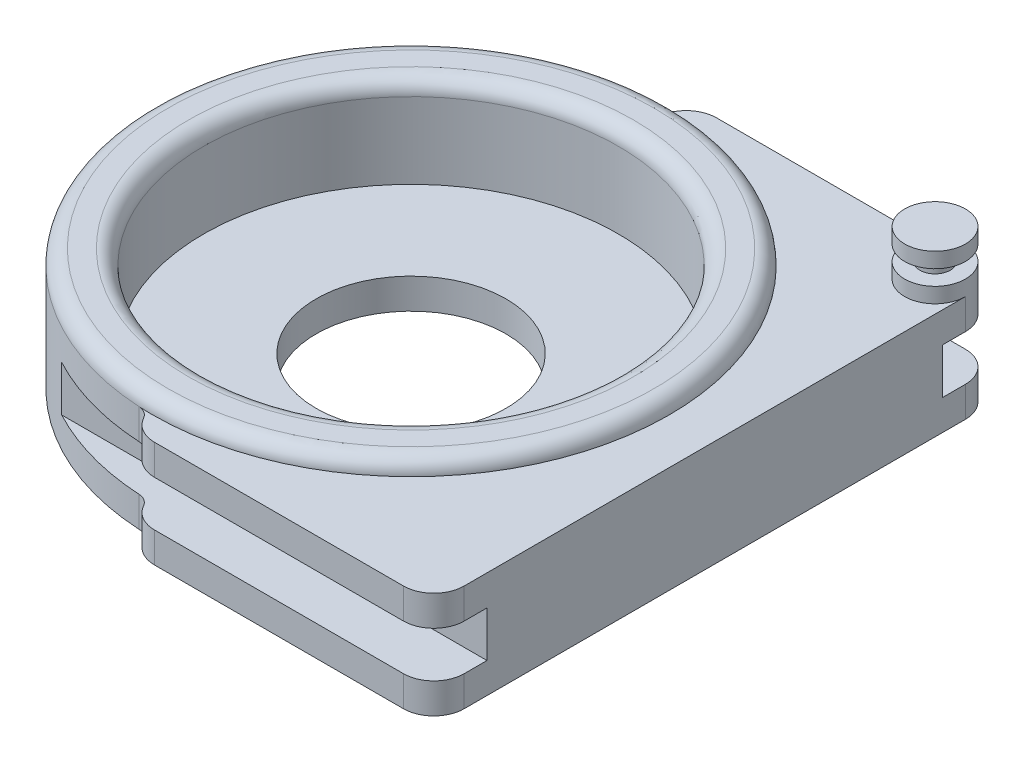
from build123d import *

# Parameters (mm, degrees)
EXTRUDE_1_DEPTH      = 2
EXTRUDE_2_DEPTH      = 3
EXTRUDE_3_DEPTH      = 2
CUT_EXTRUDE_START    = -5
SKETCH_4_R           = 13.65
SKETCH_4_R_2         = 6.25
CUT_EXTRUDE_4_DEPTH  = 5
SKETCH_4_3_R         = 13.65
EXTRUDE_5_DEPTH      = 1
FILLET_2_R           = 1
FILLET_3_R           = 2
EXTRUDE_6_DEPTH      = 1
SKETCH_6_R           = 1
EXTRUDE_7_DEPTH      = 1
SKETCH_7_R           = 2
EXTRUDE_8_DEPTH      = 1
CUT_EXTRUDE_10_DEPTH = 5


with BuildPart() as part:
    # 草图1 → 拉伸1 (new body)
    with BuildSketch(Plane(origin=(0, 0, 0), x_dir=(1, 0, 0), z_dir=(0, 1, 0))):
        with BuildLine():
            Line((0, 15), (-8, 15))
            ThreePointArc((-8, 15), (-14.577379737, 8.746427842), (-17, 0))
            ThreePointArc((-17, 0), (-14.577379737, -8.746427842), (-8, -15))
            Line((-8, -15), (0, -15))
            Line((0, -15), (0, -6.25))
            ThreePointArc((0, -6.25), (-6.25, 0), (0, 6.25))
            Line((0, 6.25), (0, 15))
        make_face()
        with BuildLine():
            Line((8, 15), (0, 15))
            Line((0, 15), (0, 6.25))
            ThreePointArc((0, 6.25), (4.419417382, 4.419417382), (6.25, 0))
            ThreePointArc((6.25, 0), (4.419417382, -4.419417382), (0, -6.25))
            Line((0, -6.25), (0, -15))
            Line((0, -15), (8, -15))
            ThreePointArc((8, -15), (14.577379737, -8.746427842), (17, 0))
            ThreePointArc((17, 0), (14.577379737, 8.746427842), (8, 15))
        make_face()
        with BuildLine():
            Line((0, 15), (-8, 15))
            ThreePointArc((-8, 15), (-14.577379737, 8.746427842), (-17, 0))
            ThreePointArc((-17, 0), (-14.577379737, -8.746427842), (-8, -15))
            Line((-8, -15), (0, -15))
            Line((0, -15), (0, -6.25))
            ThreePointArc((0, -6.25), (-6.25, 0), (0, 6.25))
            Line((0, 6.25), (0, 15))
        make_face()
        with BuildLine():
            Line((8, 15), (0, 15))
            Line((0, 15), (0, 6.25))
            ThreePointArc((0, 6.25), (4.419417382, 4.419417382), (6.25, 0))
            ThreePointArc((6.25, 0), (4.419417382, -4.419417382), (0, -6.25))
            Line((0, -6.25), (0, -15))
            Line((0, -15), (8, -15))
            ThreePointArc((8, -15), (14.577379737, -8.746427842), (17, 0))
            ThreePointArc((17, 0), (14.577379737, 8.746427842), (8, 15))
        make_face()
        with BuildLine():
            Line((20, 15), (8, 15))
            ThreePointArc((8, 15), (14.577379737, 8.746427842), (17, 0))
            ThreePointArc((17, 0), (14.577379737, -8.746427842), (8, -15))
            Line((8, -15), (20, -15))
            Line((20, -15), (20, 15))
        make_face()
        with BuildLine():
            Line((0, 18.5), (0, 17))
            ThreePointArc((0, 17), (4.123105626, 16.492422502), (8, 15))
            Line((8, 15), (20, 15))
            Line((20, 15), (20, 18.5))
            Line((20, 18.5), (0, 18.5))
        make_face()
        with BuildLine():
            ThreePointArc((8, -15), (4.123105626, -16.492422502), (0, -17))
            Line((0, -17), (0, -18.5))
            Line((0, -18.5), (20, -18.5))
            Line((20, -18.5), (20, -15))
            Line((20, -15), (8, -15))
        make_face()
        with BuildLine():
            ThreePointArc((0, 17), (-4.123105626, 16.492422502), (-8, 15))
            Line((-8, 15), (0, 15))
            Line((0, 15), (0, 17))
        make_face()
        with BuildLine():
            Line((0, 17), (0, 15))
            Line((0, 15), (8, 15))
            ThreePointArc((8, 15), (4.123105626, 16.492422502), (0, 17))
        make_face()
        with BuildLine():
            ThreePointArc((0, 17), (-4.123105626, 16.492422502), (-8, 15))
            Line((-8, 15), (0, 15))
            Line((0, 15), (0, 17))
        make_face()
        with BuildLine():
            Line((0, 17), (0, 15))
            Line((0, 15), (8, 15))
            ThreePointArc((8, 15), (4.123105626, 16.492422502), (0, 17))
        make_face()
        with BuildLine():
            Line((0, -15), (-8, -15))
            ThreePointArc((-8, -15), (-4.123105626, -16.492422502), (0, -17))
            Line((0, -17), (0, -15))
        make_face()
        with BuildLine():
            Line((8, -15), (0, -15))
            Line((0, -15), (0, -17))
            ThreePointArc((0, -17), (4.123105626, -16.492422502), (8, -15))
        make_face()
        with BuildLine():
            Line((0, -15), (-8, -15))
            ThreePointArc((-8, -15), (-4.123105626, -16.492422502), (0, -17))
            Line((0, -17), (0, -15))
        make_face()
        with BuildLine():
            Line((8, -15), (0, -15))
            Line((0, -15), (0, -17))
            ThreePointArc((0, -17), (4.123105626, -16.492422502), (8, -15))
        make_face()
    extrude(amount=EXTRUDE_1_DEPTH)

    # 草图2 → 拉伸2 (add)
    with BuildSketch(Plane(origin=(0, 2, 0), x_dir=(1, 0, 0), z_dir=(0, 1, 0))):
        with BuildLine():
            Line((0, 6.25), (0, 15))
            Line((0, 15), (-8, 15))
            ThreePointArc((-8, 15), (-14.577379737, 8.746427842), (-17, 0))
            ThreePointArc((-17, 0), (-14.577379737, -8.746427842), (-8, -15))
            Line((-8, -15), (0, -15))
            Line((0, -15), (0, -6.25))
            ThreePointArc((0, -6.25), (-6.25, 0), (0, 6.25))
        make_face()
        with BuildLine():
            ThreePointArc((17, 0), (14.577379737, 8.746427842), (8, 15))
            Line((8, 15), (0, 15))
            Line((0, 15), (0, 6.25))
            ThreePointArc((0, 6.25), (4.419417382, 4.419417382), (6.25, 0))
            ThreePointArc((6.25, 0), (4.419417382, -4.419417382), (0, -6.25))
            Line((0, -6.25), (0, -15))
            Line((0, -15), (8, -15))
            ThreePointArc((8, -15), (14.577379737, -8.746427842), (17, 0))
        make_face()
        with BuildLine():
            Line((0, 6.25), (0, 15))
            Line((0, 15), (-8, 15))
            ThreePointArc((-8, 15), (-14.577379737, 8.746427842), (-17, 0))
            ThreePointArc((-17, 0), (-14.577379737, -8.746427842), (-8, -15))
            Line((-8, -15), (0, -15))
            Line((0, -15), (0, -6.25))
            ThreePointArc((0, -6.25), (-6.25, 0), (0, 6.25))
        make_face()
        with BuildLine():
            Line((20, -15), (20, 15))
            Line((20, 15), (8, 15))
            ThreePointArc((8, 15), (14.577379737, 8.746427842), (17, 0))
            ThreePointArc((17, 0), (14.577379737, -8.746427842), (8, -15))
            Line((8, -15), (20, -15))
        make_face()
    extrude(amount=EXTRUDE_2_DEPTH)

    # 草图3 → 拉伸3 (add)
    with BuildSketch(Plane(origin=(0, 5, 0), x_dir=(1, 0, 0), z_dir=(0, 1, 0))):
        with BuildLine():
            Line((0, 6.25), (0, 15))
            Line((0, 15), (-8, 15))
            ThreePointArc((-8, 15), (-14.577379738, 8.746427841), (-17, -3e-09))
            ThreePointArc((-17, -3e-09), (-14.577379736, -8.746427843), (-8, -15))
            Line((-8, -15), (0, -15))
            Line((0, -15), (0, -6.25))
            ThreePointArc((0, -6.25), (-6.25, 0), (0, 6.25))
        make_face()
        with BuildLine():
            ThreePointArc((8, 15), (4.123105626, 16.492422502), (0, 17))
            Line((0, 17), (0, 15))
            Line((0, 15), (8, 15))
        make_face()
        with BuildLine():
            Line((0, 15), (0, 17))
            ThreePointArc((0, 17), (-4.123105626, 16.492422502), (-8, 15))
            Line((-8, 15), (0, 15))
        make_face()
        with BuildLine():
            ThreePointArc((8, 15), (4.123105626, 16.492422502), (0, 17))
            Line((0, 17), (0, 15))
            Line((0, 15), (8, 15))
        make_face()
        with BuildLine():
            Line((0, 15), (0, 17))
            ThreePointArc((0, 17), (-4.123105626, 16.492422502), (-8, 15))
            Line((-8, 15), (0, 15))
        make_face()
        with BuildLine():
            ThreePointArc((17, 0), (14.577379737, 8.746427842), (8, 15))
            Line((8, 15), (0, 15))
            Line((0, 15), (0, 6.25))
            ThreePointArc((0, 6.25), (4.419417382, 4.419417382), (6.25, 0))
            ThreePointArc((6.25, 0), (4.419417382, -4.419417382), (0, -6.25))
            Line((0, -6.25), (0, -15))
            Line((0, -15), (8, -15))
            ThreePointArc((8, -15), (14.577379737, -8.746427842), (17, 0))
        make_face()
        with BuildLine():
            Line((0, 6.25), (0, 15))
            Line((0, 15), (-8, 15))
            ThreePointArc((-8, 15), (-14.577379738, 8.746427841), (-17, -3e-09))
            ThreePointArc((-17, -3e-09), (-14.577379736, -8.746427843), (-8, -15))
            Line((-8, -15), (0, -15))
            Line((0, -15), (0, -6.25))
            ThreePointArc((0, -6.25), (-6.25, 0), (0, 6.25))
        make_face()
        with BuildLine():
            ThreePointArc((0, -17), (4.123105626, -16.492422502), (8, -15))
            Line((8, -15), (0, -15))
            Line((0, -15), (0, -17))
        make_face()
        with BuildLine():
            Line((0, -17), (0, -15))
            Line((0, -15), (-8, -15))
            ThreePointArc((-8, -15), (-4.123105626, -16.492422502), (0, -17))
        make_face()
        with BuildLine():
            ThreePointArc((0, -17), (4.123105626, -16.492422502), (8, -15))
            Line((8, -15), (0, -15))
            Line((0, -15), (0, -17))
        make_face()
        with BuildLine():
            Line((0, -17), (0, -15))
            Line((0, -15), (-8, -15))
            ThreePointArc((-8, -15), (-4.123105626, -16.492422502), (0, -17))
        make_face()
        with BuildLine():
            Line((20, -15), (20, 15))
            Line((20, 15), (8, 15))
            ThreePointArc((8, 15), (14.577379737, 8.746427842), (17, 0))
            ThreePointArc((17, 0), (14.577379737, -8.746427842), (8, -15))
            Line((8, -15), (20, -15))
        make_face()
        with BuildLine():
            Line((20, 15), (20, 18.5))
            Line((20, 18.5), (0, 18.5))
            Line((0, 18.5), (0, 17))
            ThreePointArc((0, 17), (4.123105626, 16.492422502), (8, 15))
            Line((8, 15), (20, 15))
        make_face()
        with BuildLine():
            Line((20, -18.5), (20, -15))
            Line((20, -15), (8, -15))
            ThreePointArc((8, -15), (4.123105626, -16.492422502), (0, -17))
            Line((0, -17), (0, -18.5))
            Line((0, -18.5), (20, -18.5))
        make_face()
    extrude(amount=EXTRUDE_3_DEPTH)

    # 草图4 → 拉伸4 (cut)
    with BuildSketch(Plane(origin=(0, 7, 0), x_dir=(1, 0, 0), z_dir=(0, 1, 0)).offset(CUT_EXTRUDE_START)):
        with Locations(Location((0, 0, 0), (0, 0, 270))):
            Circle(SKETCH_4_R)
        with Locations(Location((0, 0, 0), (0, 0, 270))):
            Circle(SKETCH_4_R_2, mode=Mode.SUBTRACT)
    extrude(amount=CUT_EXTRUDE_4_DEPTH, mode=Mode.SUBTRACT)

    # 草图4<3> → 拉伸5 (add)
    with BuildSketch(Plane(origin=(0, 7, 0), x_dir=(1, 0, 0), z_dir=(0, 1, 0))):
        with BuildLine():
            ThreePointArc((0, 17), (-17, 0), (0, -17))
            ThreePointArc((0, -17), (12.02081528, -12.02081528), (17, 0))
            ThreePointArc((17, 0), (12.02081528, 12.02081528), (0, 17))
        make_face()
        with Locations(Location((0, 0, 0), (0, 0, 270))):
            Circle(SKETCH_4_3_R, mode=Mode.SUBTRACT)
    extrude(amount=EXTRUDE_5_DEPTH)

    # 圆角1: read off the stored shape, not the designer's step
    # 圆角1 outline → 圆角1 (revolve, cut)
    with BuildSketch(Plane.XY):
        with BuildLine():
            ThreePointArc((16, 8), (16.707106781, 7.707106781), (17, 7))
            Line((17, 7), (17, 8))
            Line((17, 8), (16, 8))
        make_face()
        with BuildLine():
            ThreePointArc((13.65, 7), (13.942893219, 7.707106781), (14.65, 8))
            Line((14.65, 8), (13.65, 8))
            Line((13.65, 8), (13.65, 7))
        make_face()
    revolve(axis=Axis((0, 0, 0), (0, 1, 0)), mode=Mode.SUBTRACT)

    # 圆角2
    # the kernel refuses this fillet: 1 mm, written as the material it adds along each edge
    with BuildSketch(Plane(origin=(0, 0, -17), x_dir=(-0.9996138248178563, 0, 0.027788509010311935), z_dir=(0, 1, 0)), Plane(origin=(0, 5, -17), x_dir=(-0.9996138248178565, 0, 0.027788509010305), z_dir=(0, 1, 0))) as fillet_2_piece_1:
        with BuildLine():
            CenterArc((0.972597815, -0.999613825), FILLET_2_R, 91.592369268, 86.815261463)
            Line((-0.027016009, -0.971825316), (0, 0))
            ThreePointArc((0, 0), (0.472404653, -0.006564978), (0.944809306, 0))
        make_face()
    extrude(amount=2)
    with BuildSketch(Plane(origin=(0, 0, 17), x_dir=(-0.9996138248178561, 0, -0.027788509010319186), z_dir=(0, 1, 0)), Plane(origin=(0, 5, 17), x_dir=(-0.9996138248178563, 0, -0.027788509010312518), z_dir=(0, 1, 0))) as fillet_2_piece_2:
        with BuildLine():
            CenterArc((0.972597815, 0.999613825), FILLET_2_R, 181.592369268, 86.815261463)
            Line((-0.027016009, 0.971825316), (0, 0))
            ThreePointArc((0, 0), (0.472404653, 0.006564978), (0.944809306, 0))
        make_face()
    extrude(amount=2)

    # 圆角3
    # the kernel refuses this fillet: 2 mm, written as the material it takes off along each edge
    with BuildSketch(Plane(origin=(0, -4.034822556, -18.5), x_dir=(-0.12535212734236612, 0, 0.992112314292461), z_dir=(0, 1, 0))) as fillet_3_piece_1:
        with BuildLine():
            CenterArc((1.781915192, 1.851903112), FILLET_3_R, 187.201091139, 60.611190589)
            Line((-0.202309436, 1.601198858), (-0.400731899, 1.576128432))
            Line((-0.400731899, 1.576128432), (-0.198422463, -0.025070425))
            Line((-0.198422463, -0.025070425), (0.025070425, -0.198422463))
            ThreePointArc((0.025070425, -0.198422463), (0.548706555, -0.132261705), (0.951102107, -0.185190311))
            Line((0.951102107, -0.185190311), (1.026630569, 0))
        make_face()
    extrude(amount=10.069645113, mode=Mode.SUBTRACT)
    with BuildSketch(Plane(origin=(20, -5, -18.5), x_dir=(0, 0, 1), z_dir=(0, 1, 0)), Plane(origin=(20, 0, 18.5), x_dir=(-1, 0, 0), z_dir=(0, 1, 0)), Plane(origin=(20, 0, -18.5), x_dir=(0, 0, 1), z_dir=(0, 1, 0))) as fillet_3_piece_2:
        with BuildLine():
            CenterArc((FILLET_3_R, -FILLET_3_R), FILLET_3_R, 90, 90)
            Line((0, -FILLET_3_R), (0, 0))
            Line((0, 0), (FILLET_3_R, 0))
        make_face()
    extrude(amount=12, mode=Mode.SUBTRACT)
    with BuildSketch(Plane(origin=(20, -5, 18.5), x_dir=(0, 0, -1), z_dir=(0, 1, 0))) as fillet_3_piece_3:
        with BuildLine():
            CenterArc((FILLET_3_R, FILLET_3_R), FILLET_3_R, 180, 90)
            Line((0, FILLET_3_R), (0, 0))
            Line((0, 0), (FILLET_3_R, 0))
        make_face()
    extrude(amount=12, mode=Mode.SUBTRACT)
    with BuildSketch(Plane(origin=(0, -4.034822556, 18.5), x_dir=(-0.12535212734236506, 0, -0.9921123142924613), z_dir=(0, 1, 0))) as fillet_3_piece_4:
        with BuildLine():
            CenterArc((1.781915192, -1.851903112), FILLET_3_R, 112.187718272, 60.611190589)
            Line((-0.202309436, -1.601198858), (-0.400731899, -1.576128432))
            Line((-0.400731899, -1.576128432), (-0.198422463, 0.025070425))
            Line((-0.198422463, 0.025070425), (0.025070425, 0.198422463))
            ThreePointArc((0.025070425, 0.198422463), (0.548706555, 0.132261705), (0.951102107, 0.185190311))
            Line((0.951102107, 0.185190311), (1.026630569, 0))
        make_face()
    extrude(amount=10.069645113, mode=Mode.SUBTRACT)
    with BuildSketch(Plane(origin=(0, 0.965177444, 18.5), x_dir=(1, 0, 0), z_dir=(0, 1, 0))) as fillet_3_piece_5:
        with BuildLine():
            CenterArc((1.613929023, 2), FILLET_3_R, 209.388809411, 60.611190589)
            Line((-0.128690326, 1.01853283), (-0.302952261, 0.920386113))
            ThreePointArc((-0.302952261, 0.920386113), (-0.2, 0.527799244), (-0.2, 0))
            Line((-0.2, 0), (0, -0.2))
            Line((0, -0.2), (1.613929023, -0.2))
            Line((1.613929023, -0.2), (1.613929023, 0))
        make_face()
    extrude(amount=10.069645113, mode=Mode.SUBTRACT)
    with BuildSketch(Plane(origin=(0, 0.965177444, -18.5), x_dir=(1, 0, 0), z_dir=(0, 1, 0))) as fillet_3_piece_6:
        with BuildLine():
            CenterArc((1.613929023, -2), FILLET_3_R, 90, 60.611190589)
            Line((-0.128690326, -1.01853283), (-0.302952261, -0.920386113))
            ThreePointArc((-0.302952261, -0.920386113), (-0.2, -0.527799244), (-0.2, 0))
            Line((-0.2, 0), (0, 0.2))
            Line((0, 0.2), (1.613929023, 0.2))
            Line((1.613929023, 0.2), (1.613929023, 0))
        make_face()
    extrude(amount=10.069645113, mode=Mode.SUBTRACT)

    # 草图5 → 拉伸6 (add)
    with BuildSketch(Plane(origin=(0, 7, 0), x_dir=(1, 0, 0), z_dir=(0, 1, 0))):
        with BuildLine():
            ThreePointArc((18, 18.5), (16.585786438, 15.085786438), (20, 16.5))
            ThreePointArc((20, 16.5), (19.414213562, 17.914213562), (18, 18.5))
        make_face()
    extrude(amount=EXTRUDE_6_DEPTH)

    # 草图6 → 拉伸7 (add)
    with BuildSketch(Plane(origin=(0, 8, 0), x_dir=(1, 0, 0), z_dir=(0, 1, 0))):
        with Locations(Location((18, 16.5, 0), (0, 0, 270))):
            Circle(SKETCH_6_R)
    extrude(amount=EXTRUDE_7_DEPTH)

    # 草图7 → 拉伸8 (add)
    with BuildSketch(Plane(origin=(0, 9, 0), x_dir=(1, 0, 0), z_dir=(0, 1, 0))):
        with Locations(Location((18, 16.5, 0), (0, 0, 270))):
            Circle(SKETCH_7_R)
    extrude(amount=EXTRUDE_8_DEPTH)

    # 草图8 → 拉伸10 (cut)
    with BuildSketch(Plane.XZ):
        with BuildLine():
            Line((9.643650761, -14), (19, -14))
            Line((19, -14), (19, 14))
            Line((19, 14), (9.643650761, 14))
            ThreePointArc((9.643650761, 14), (15.048954498, 7.907526069), (17, 0))
            ThreePointArc((17, 0), (15.048954498, -7.907526069), (9.643650761, -14))
        make_face()
    extrude(amount=-CUT_EXTRUDE_10_DEPTH, mode=Mode.SUBTRACT)


solid = part.part
